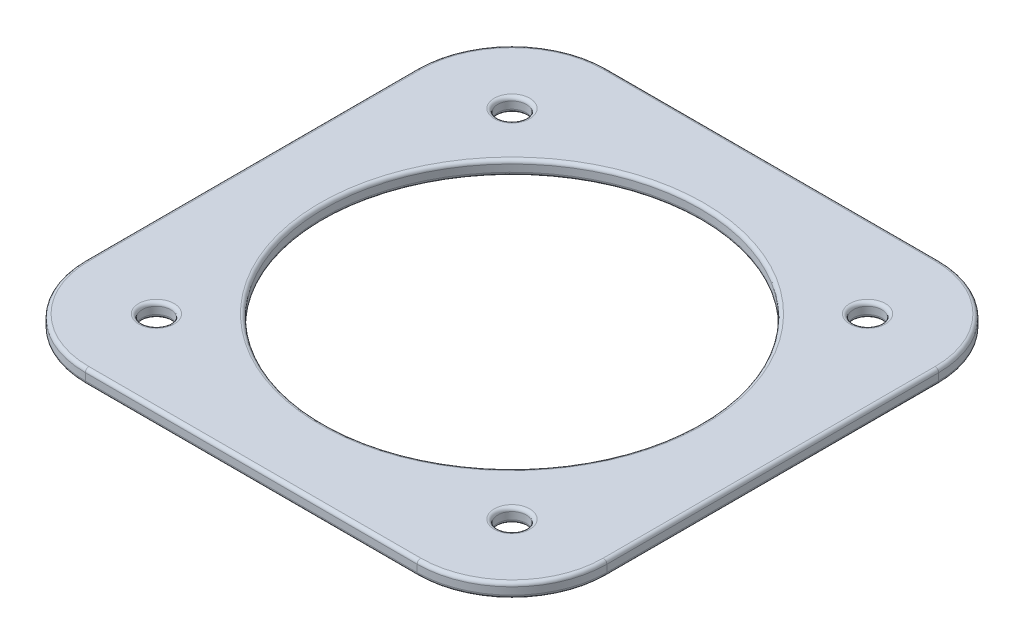
from build123d import *

# Parameters (mm, degrees)
SKETCH1_R                      = 79.5
BOSS_EXTRUDE1_DEPTH            = 6
CBORE_FOR_M10_SHCS_D           = 12
CBORE_FOR_M10_SHCS_CBORE_D     = 18
CBORE_FOR_M10_SHCS_CBORE_DEPTH = 10
FILLET1_R                      = 1.5


with BuildPart() as part:
    # Sketch1 → Boss-Extrude1 (new body)
    with BuildSketch(Plane(origin=(0, 0, 0), x_dir=(1, 0, 0), z_dir=(0, 1, 0))):
        with BuildLine():
            Line((-70, -110), (70, -110))
            ThreePointArc((70, -110), (98.284271247, -98.284271247), (110, -70))
            Line((110, -70), (110, 70))
            ThreePointArc((110, 70), (98.284271247, 98.284271247), (70, 110))
            Line((70, 110), (-70, 110))
            ThreePointArc((-70, 110), (-98.284271247, 98.284271247), (-110, 70))
            Line((-110, 70), (-110, -70))
            ThreePointArc((-110, -70), (-98.284271247, -98.284271247), (-70, -110))
        make_face()
        Circle(SKETCH1_R, mode=Mode.SUBTRACT)
    extrude(amount=BOSS_EXTRUDE1_DEPTH)

    # CBORE for M10 SHCS (through all)
    with Locations(Plane(origin=(0, 21, 0), x_dir=(1, 0, 0), z_dir=(0, 1, 0))):
        with Locations((0, 0), (-75, 75), (75, 75), (75, -75), (-75, -75)):
            CounterBoreHole(CBORE_FOR_M10_SHCS_D / 2, CBORE_FOR_M10_SHCS_CBORE_D / 2, CBORE_FOR_M10_SHCS_CBORE_DEPTH)

    # Fillet1
    fillet1_edges = [part.edges().sort_by_distance(p)[0] for p in [
        (-79.5, 0, 0),
        (0, 0, 110),
        (98.284271247, 0, 98.284271247),
        (110, 0, 0),
        (98.284271247, 0, -98.284271247),
        (0, 0, -110),
        (-98.284271247, 0, -98.284271247),
        (-110, 0, 0),
        (-98.284271247, 0, 98.284271247),
        (-79.5, 6, 0),
        (-110, 6, 0),
        (-98.284271247, 6, -98.284271247),
        (0, 6, -110),
        (98.284271247, 6, -98.284271247),
        (110, 6, 0),
        (98.284271247, 6, 98.284271247),
        (0, 6, 110),
        (-98.284271247, 6, 98.284271247),
        (-69, 0, 75),
        (81, 0, 75),
        (81, 0, -75),
        (-69, 0, -75),
        (-69, 6, 75),
        (81, 6, 75),
        (81, 6, -75),
        (-69, 6, -75),
    ]]
    fillet(fillet1_edges, radius=FILLET1_R)


solid = part.part
